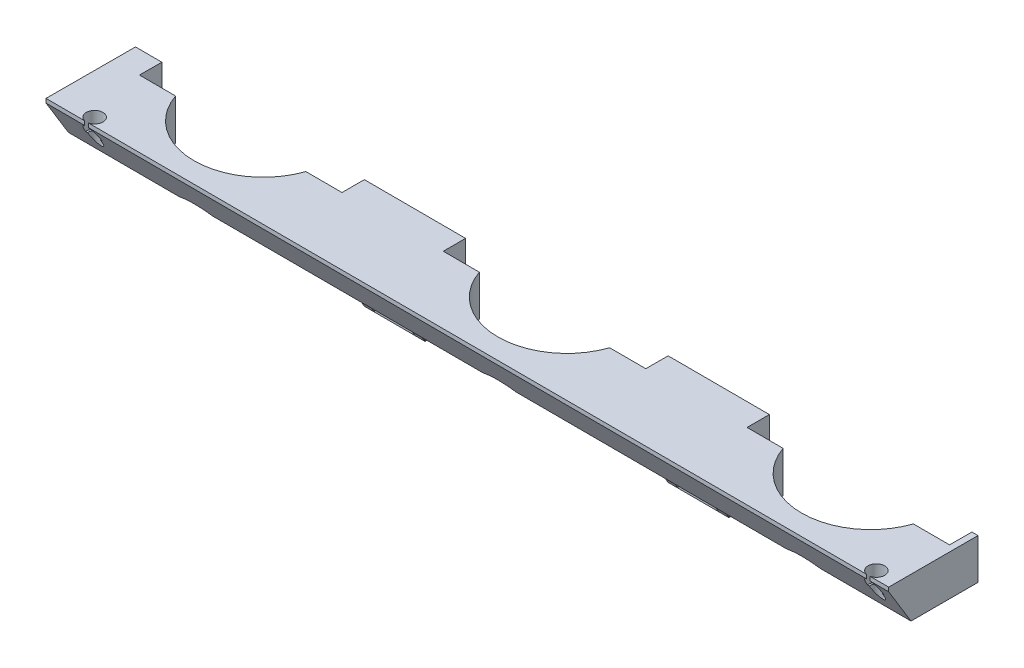
from build123d import *

# Parameters (mm, degrees)
BOSS_EXTRUDE3_DEPTH        = 10
SKETCH4_R                  = 1.5
BOSS_EXTRUDE4_DEPTH        = 5
RIB6_REACH                 = 158.985
SKETCH5_WALL_W             = 329.861950248
SKETCH5_WALL_H             = 2.5
CHAMFER2_SIZE              = 1
CHAMFER3_SIZE              = 5.5
CHAMFER3_SIZE_2            = 9
LPATTERN4_COUNT            = 2
LPATTERN4_PITCH            = 75
LPATTERN4_COPY_1_REACH     = 158.985
LPATTERN4_COPY_1_SKETCH_W  = 329.861950248
LPATTERN4_COPY_1_SKETCH_H  = 2.5
CHAMFER2_OF_LPATTERN4_SIZE = 1
SKETCH8_R                  = 2.05
CUT_EXTRUDE1_DEPTH         = 4
SKETCH9_R                  = 1.6
CUT_EXTRUDE2_DEPTH         = 5
SZKIC1_W                   = 8.551960468
SZKIC1_H                   = 23.590081372
WYTNIJ_WYCI_GNI_CIE3_DEPTH = 30.5


with BuildPart() as part:
    # Sketch2 → Boss-Extrude3 (new body)
    with BuildSketch(Plane(origin=(0, 0, 0), x_dir=(1, 0, 0), z_dir=(0, 1, 0))):
        with BuildLine():
            Line((-138.973021921, 39.179223473), (-139.022764358, 17.179279707))
            Line((-139.022764358, 17.179279707), (73.976691191, 16.697682479))
            Line((73.976691191, 16.697682479), (74.026978079, 38.697625014))
            Line((74.026978079, 38.697625014), (67.526578048, 38.712322585))
            Line((67.526578048, 38.712322585), (67.51414235, 33.212297518))
            Line((67.51414235, 33.212297518), (58.599731895, 33.232453229))
            ThreePointArc((58.599731895, 33.232453229), (42.488076808, 21.768891824), (26.428425, 33.305193378))
            Line((26.428425, 33.305193378), (17.51414235, 33.3253488))
            Line((17.51414235, 33.3253488), (17.526578048, 38.825373866))
            Line((17.526578048, 38.825373866), (-7.473230244, 38.881899074))
            Line((-7.473230244, 38.881899074), (-7.485665941, 33.381874007))
            Line((-7.485665941, 33.381874007), (-16.400076396, 33.402029717))
            ThreePointArc((-16.400076396, 33.402029717), (-32.511731484, 21.938468313), (-48.571383292, 33.474769867))
            Line((-48.571383292, 33.474769867), (-57.485665941, 33.494925288))
            Line((-57.485665941, 33.494925288), (-57.473230244, 38.994950355))
            Line((-57.473230244, 38.994950355), (-82.473038536, 39.051475562))
            Line((-82.473038536, 39.051475562), (-82.485474233, 33.551450496))
            Line((-82.485474233, 33.551450496), (-91.399884688, 33.571606206))
            ThreePointArc((-91.399884688, 33.571606206), (-107.511539776, 22.108044802), (-123.571191584, 33.644346356))
            Line((-123.571191584, 33.644346356), (-132.485474233, 33.664501777))
            Line((-132.485474233, 33.664501777), (-132.473038536, 39.164526844))
            Line((-132.473038536, 39.164526844), (-138.973021921, 39.179223473))
        make_face()
    extrude(amount=BOSS_EXTRUDE3_DEPTH)

    # Sketch4 → Boss-Extrude4 (add)
    with BuildSketch(Plane(origin=(0.087874316, 0, -38.864803222), x_dir=(-0.99999744389135, 0, -0.002261019850970016), z_dir=(0.002261019850970016, 0, -0.99999744389135))):
        Polygon((62.56118779, -12), (57.561251693, 0), (82.561123887, 0), (77.56118779, -12), align=None)
        with Locations((70.06118779, -8.5)):
            Circle(SKETCH4_R, mode=Mode.SUBTRACT)
    boss_extrude4 = extrude(amount=-BOSS_EXTRUDE4_DEPTH)

    # Sketch5 wall → Rib6 (add, up to next)
    with BuildSketch(Plane(origin=(-77.492333887, -6, -30.540192335), x_dir=(-0.001139262394, 0.863778900906, 0.503869737562), z_dir=(-0.001953021242, -0.503871025511, 0.863776692993)), mode=Mode.PRIVATE) as rib6_sk1:
        with Locations((0, -1.25)):
            Rectangle(SKETCH5_WALL_W, SKETCH5_WALL_H)
    rib6_tool1 = extrude(rib6_sk1.sketch, amount=-RIB6_REACH, mode=Mode.PRIVATE) - part.part
    rib6 = rib6_tool1.solids().sort_by_distance((-77.492333887, -6, -30.540192335))[0]
    add(rib6)

    # Mirror2: Rib6 across plane
    add(rib6.mirror(Plane(origin=(-70.061008706, 0, -0.158409736), x_dir=(-0.0022610198509701073, 0, 0.99999744389135), z_dir=(0.99999744389135, 0, 0.002261019850970107))))

    # Chamfer2
    chamfer2_edges = [part.edges().sort_by_distance(p)[0] for p in [
        (-68.484443323, -8.5, -34.01983421),
    ]]
    chamfer(chamfer2_edges, length=CHAMFER2_SIZE)

    # Chamfer3
    # the kernel refuses this chamfer: 9, 5.5 mm, written as the material it takes off along each edge
    with BuildSketch(Plane(origin=(-162.295390883, 0, -17.231899712), x_dir=(0.0022577295255832275, -0.053929224624231706, -0.9985422081158205), z_dir=(0.9999974438913499, 0, 0.0022610198509699707))) as chamfer3_piece_1:
        Polygon((CHAMFER3_SIZE * 0.998544760505, CHAMFER3_SIZE * 0.0539292246242), (-CHAMFER3_SIZE_2 * 0.0539292246242, CHAMFER3_SIZE_2 * 0.998544760505), (0, 0), align=None)
    extrude(amount=259.545372026, mode=Mode.SUBTRACT)

    # LPattern4: Boss-Extrude4, Rib6 ×2
    with Locations(*[Vector(0.9999974438913499, 0, 0.0022610198509701) * (i * LPATTERN4_PITCH) for i in range(1, LPATTERN4_COUNT)]):
        add(boss_extrude4)
        add(rib6)

    # LPattern4 copy 1 sketch → LPattern4 copy 1 (add, up to next)
    with BuildSketch(Plane(origin=(12.507436062, -6, -30.336700548), x_dir=(-0.0011392623880184954, 0.863778900906, 0.5038697375620136), z_dir=(-0.0019530212415939509, -0.503871025511, 0.863776692993001)), mode=Mode.PRIVATE) as lpattern4_copy_1_sk1:
        with Locations((0, 1.25)):
            Rectangle(LPATTERN4_COPY_1_SKETCH_W, LPATTERN4_COPY_1_SKETCH_H)
    lpattern4_copy_1_tool1 = extrude(lpattern4_copy_1_sk1.sketch, amount=-LPATTERN4_COPY_1_REACH, mode=Mode.PRIVATE) - part.part
    add(lpattern4_copy_1_tool1.solids().sort_by_distance((12.507436062, -6, -30.336700548))[0])

    # Chamfer2 of LPattern4
    chamfer2_of_lpattern4_edges = [part.edges().sort_by_distance(p)[0] for p in [
        (6.515364969, -8.5, -33.850257721),
    ]]
    chamfer(chamfer2_of_lpattern4_edges, length=CHAMFER2_OF_LPATTERN4_SIZE)

    # Sketch8 → Cut-Extrude1 (cut)
    with BuildSketch(Plane(origin=(0, 10, 0), x_dir=(1, 0, 0), z_dir=(0, 1, 0))):
        with Locations((-129.018242433, 19.156613217)):
            Circle(SKETCH8_R)
    cut_extrude1 = extrude(amount=-CUT_EXTRUDE1_DEPTH, mode=Mode.SUBTRACT)

    # Sketch9 → Cut-Extrude2 (cut)
    with BuildSketch(Plane(origin=(0, 6, 0), x_dir=(1, 0, 0), z_dir=(0, 1, 0))):
        with Locations((-129.018242433, 19.156613217)):
            Circle(SKETCH9_R)
    cut_extrude2 = extrude(amount=-CUT_EXTRUDE2_DEPTH, mode=Mode.SUBTRACT)

    # Mirror4: Cut-Extrude1, Cut-Extrude2 across plane
    add(cut_extrude1.mirror(Plane(origin=(-32.561168463, 0, -0.073621636), x_dir=(-0.002261019850969509, 0, 0.99999744389135), z_dir=(-0.99999744389135, 0, -0.0022610198509695084))), mode=Mode.SUBTRACT)
    add(cut_extrude2.mirror(Plane(origin=(-32.561168463, 0, -0.073621636), x_dir=(-0.002261019850969509, 0, 0.99999744389135), z_dir=(-0.99999744389135, 0, -0.0022610198509695084))), mode=Mode.SUBTRACT)

    # Szkic1 → Wytnij-wyciągnięcie3 (cut)
    with BuildSketch(Plane(origin=(0, 10, 0), x_dir=(1, 0, 0), z_dir=(0, 1, 0))):
        with Locations((73.302426643, 26.913890658)):
            Rectangle(SZKIC1_W, SZKIC1_H)
    extrude(amount=-WYTNIJ_WYCI_GNI_CIE3_DEPTH, mode=Mode.SUBTRACT)


solid = part.part
